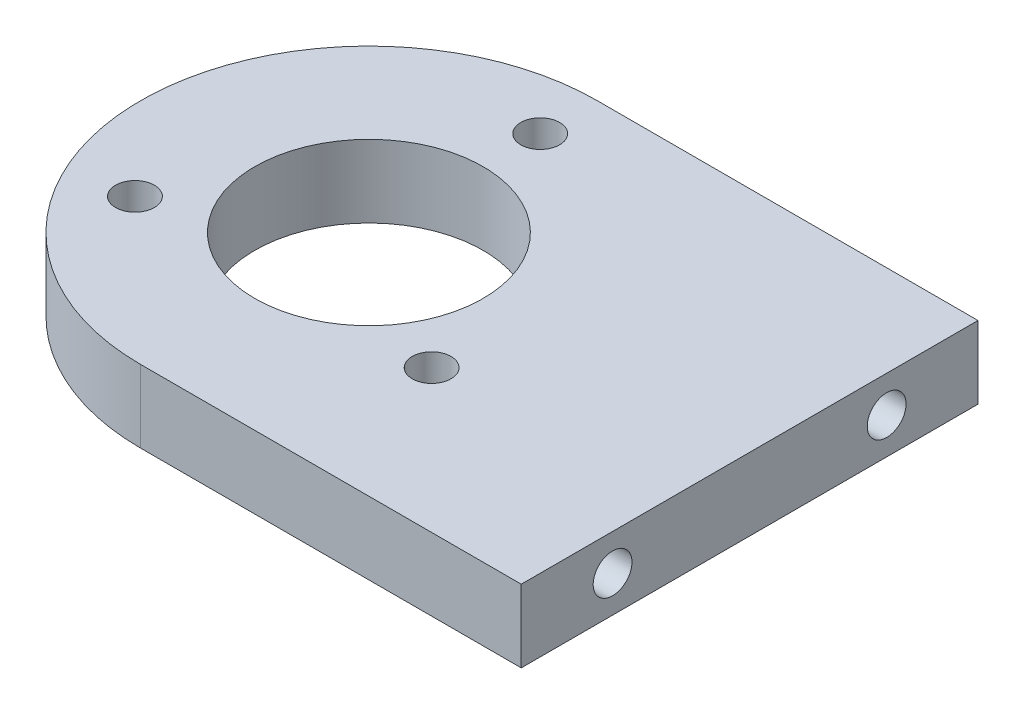
from build123d import *

# Parameters (mm, degrees)
SKETCH1_R                = 10
BOSS_EXTRUDE1_DEPTH      = 6.35
M3_CLEARANCE_HOLE1_D     = 3.4
M3_CLEARANCE_HOLE2_D     = 3.4
M3_CLEARANCE_HOLE2_DEPTH = 7
M3_CLEARANCE_HOLE2_TIP   = 1.021463052


with BuildPart() as part:
    # Sketch1 → Boss-Extrude1 (new body)
    with BuildSketch(Plane(origin=(0, 0, 0), x_dir=(1, 0, 0), z_dir=(0, 1, 0))):
        with BuildLine():
            Line((33.34, 20), (33.34, -20))
            Line((33.34, -20), (0, -20))
            ThreePointArc((0, -20), (-20, 0), (0, 20))
            Line((0, 20), (33.34, 20))
        make_face()
        Circle(SKETCH1_R, mode=Mode.SUBTRACT)
    extrude(amount=BOSS_EXTRUDE1_DEPTH)

    # M3 Clearance Hole1 (through all)
    with Locations(Plane(origin=(0, 6.35, 0), x_dir=(1, 0, 0), z_dir=(0, 1, 0))):
        with Locations((0, 15), (12.991881057, -7.499133975), (-12.988881057, -7.500866025), (0.001, 0)):
            Hole(M3_CLEARANCE_HOLE1_D / 2)

    # M3 Clearance Hole2
    with Locations(Plane(origin=(33.34, 0, 0), x_dir=(0, 0, -1), z_dir=(1, 0, 0))):
        with Locations((12, 3.175), (-12, 3.175)):
            Hole(M3_CLEARANCE_HOLE2_D / 2, depth=M3_CLEARANCE_HOLE2_DEPTH)
            with Locations((0, 0, -(M3_CLEARANCE_HOLE2_DEPTH + M3_CLEARANCE_HOLE2_TIP / 2))):  # 118° drill point
                Cone(0, M3_CLEARANCE_HOLE2_D / 2, M3_CLEARANCE_HOLE2_TIP, mode=Mode.SUBTRACT)


solid = part.part
